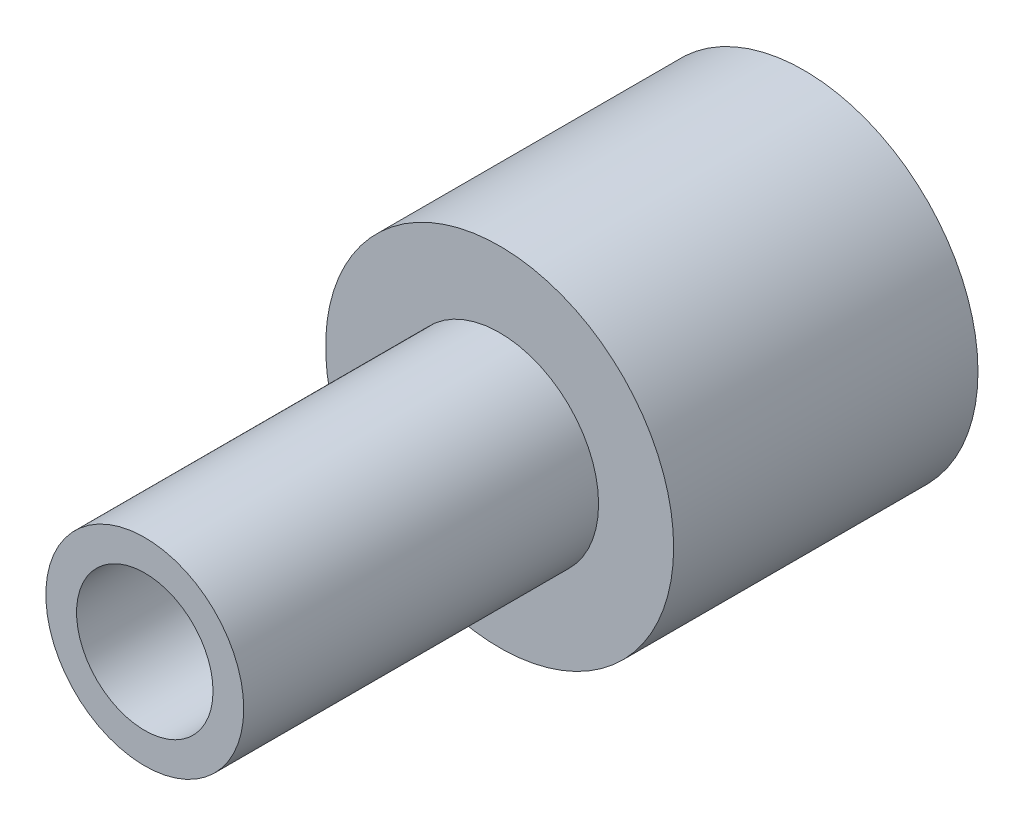
from build123d import *

# Parameters (mm, degrees)
SKETCH1_R          = 0.6477
SKETCH1_R_2        = 0.254
EXTRUDE1_DEPTH     = 1.13284
SKETCH2_R          = 0.3683
EXTRUDE2_DEPTH     = 1.3208
CUT_EXTRUDE1_REACH = 3.607
SKETCH4_R          = 0.254


with BuildPart() as part:
    # Sketch1 → Extrude1 (new body)
    with BuildSketch(Plane.XY):
        Circle(SKETCH1_R)
        Circle(SKETCH1_R_2, mode=Mode.SUBTRACT)
    extrude(amount=-EXTRUDE1_DEPTH)

    # Sketch2 → Extrude2 (add)
    with BuildSketch(Plane.XY):
        Circle(SKETCH2_R)
    extrude(amount=EXTRUDE2_DEPTH)

    # Sketch4 → Cut-Extrude1 (cut, up to next)
    with BuildSketch(Plane(origin=(0, 0, 0), x_dir=(-1, 0, 0), z_dir=(0, 0, -1)), mode=Mode.PRIVATE) as cut_extrude1_sk1:
        Circle(SKETCH4_R)
    cut_extrude1_tool1 = extrude(cut_extrude1_sk1.sketch, amount=-CUT_EXTRUDE1_REACH, mode=Mode.PRIVATE) & part.part
    add(cut_extrude1_tool1.solids().sort_by_distance((0, 0, 0))[0], mode=Mode.SUBTRACT)


solid = part.part
